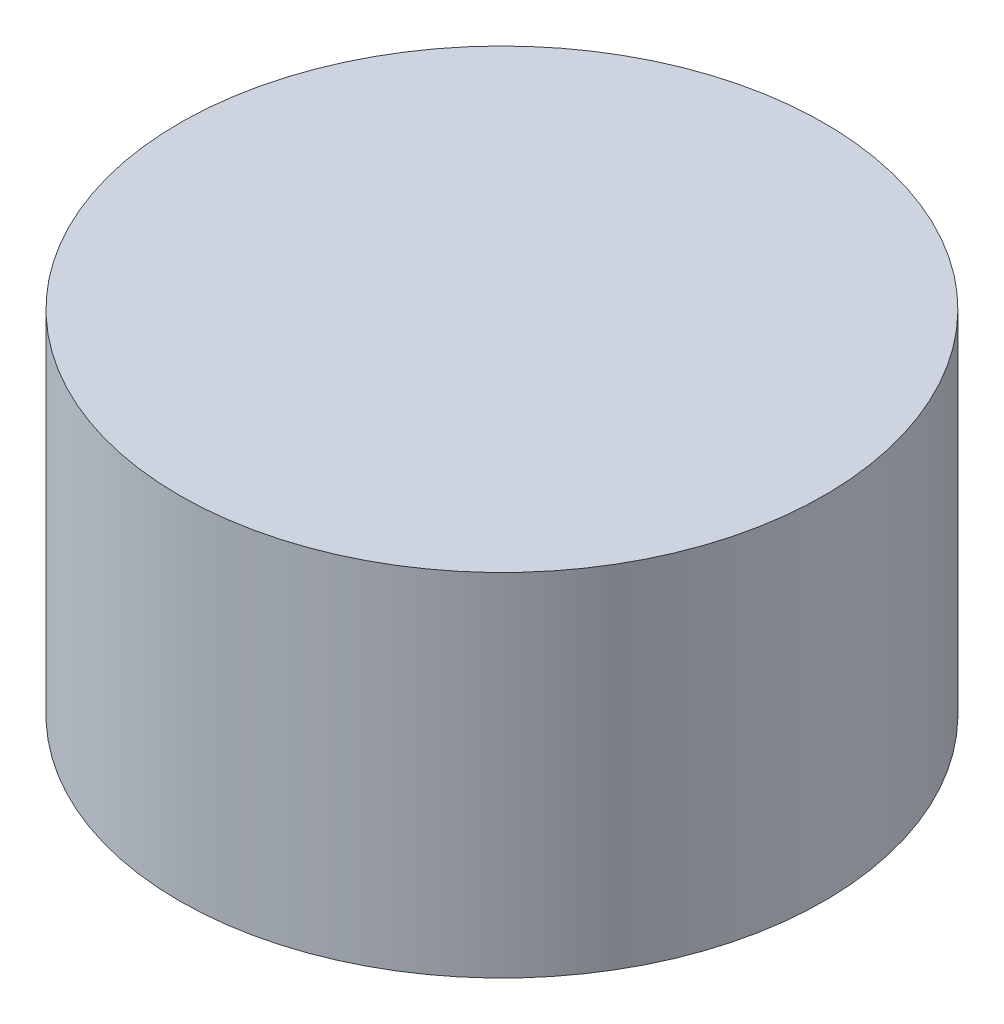
from build123d import *

# Parameters (mm, degrees)
SKETCH1_R           = 280
SKETCH1_R_2         = 275
BOSS_EXTRUDE1_DEPTH = 300
SKETCH2_R           = 280
BOSS_EXTRUDE2_DEPTH = 5


with BuildPart() as part:
    # Sketch1 → Boss-Extrude1 (new body)
    with BuildSketch(Plane(origin=(0, 0, 0), x_dir=(1, 0, 0), z_dir=(0, 1, 0))):
        Circle(SKETCH1_R)
        Circle(SKETCH1_R_2, mode=Mode.SUBTRACT)
    extrude(amount=BOSS_EXTRUDE1_DEPTH)

    # Sketch2 → Boss-Extrude2 (add)
    with BuildSketch(Plane(origin=(0, 300, 0), x_dir=(1, 0, 0), z_dir=(0, 1, 0))):
        Circle(SKETCH2_R)
    extrude(amount=BOSS_EXTRUDE2_DEPTH)


solid = part.part
